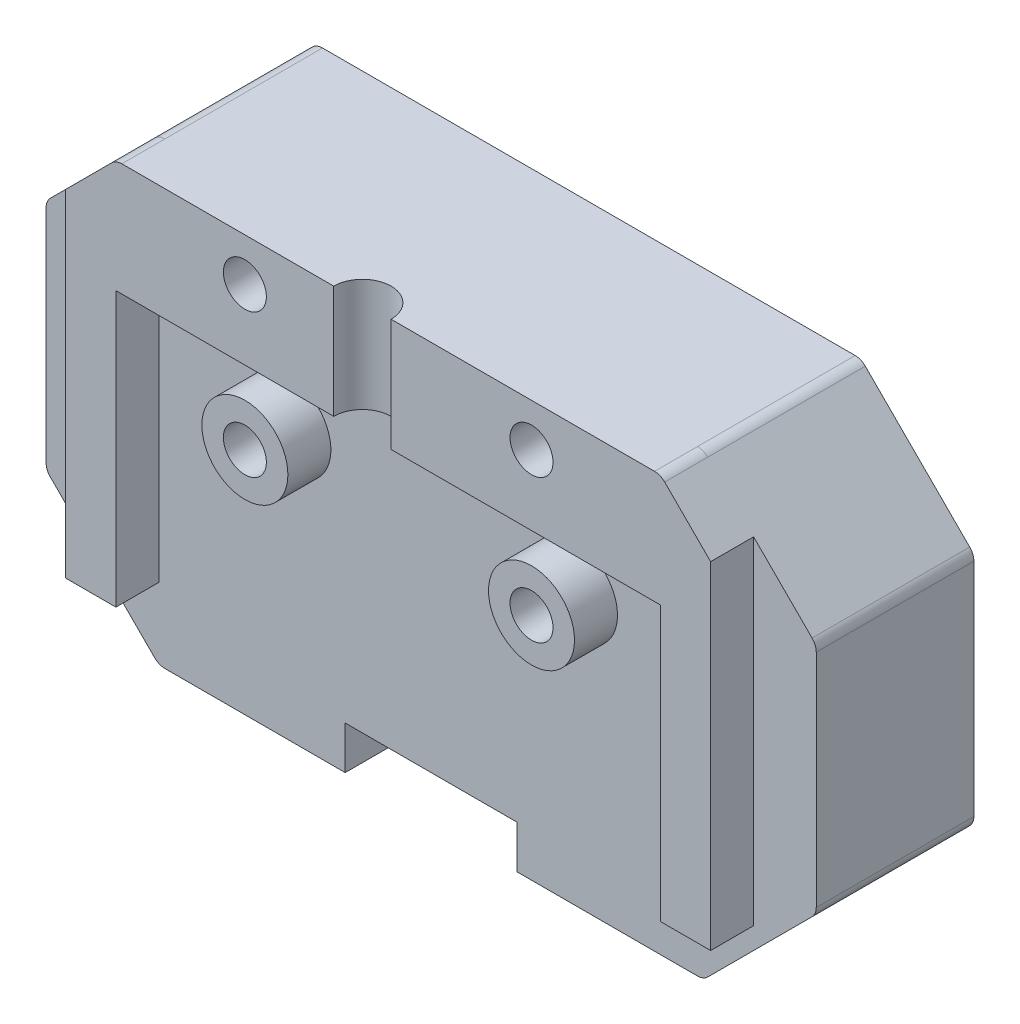
from build123d import *

# Parameters (mm, degrees)
CROQUIS3_W                   = 38
CROQUIS3_H                   = 38
SALIENTE_EXTRUIR9_DEPTH      = 1
SALIENTE_EXTRUIR10_START     = -11
SALIENTE_EXTRUIR10_OUTLINE_W = 38
SALIENTE_EXTRUIR10_OUTLINE_H = 38
SALIENTE_EXTRUIR10_DEPTH     = 10
CROQUIS13_W                  = 38
CROQUIS13_H                  = 38
SALIENTE_EXTRUIR15_DEPTH     = 3
CROQUIS14_R                  = 1.5
CORTAR_EXTRUIR1_DEPTH        = 14
CROQUIS15_W                  = 38
CROQUIS15_H                  = 24.129942315
CROQUIS15_R                  = 3.5
SALIENTE_EXTRUIR16_DEPTH     = 1
CORTAR_EXTRUIR2_DEPTH        = 14
SALIENTE_EXTRUIR17_DEPTH     = 5
SALIENTE_EXTRUIR18_DEPTH     = 5
CORTAR_EXTRUIR3_DEPTH        = 3
REDONDEO11_R                 = 1
CROQUIS21_R                  = 1.5
CORTAR_EXTRUIR4_DEPTH        = 11
SALIENTE_EXTRUIR20_START     = 3
CROQUIS22_R                  = 3
CROQUIS22_R_2                = 1.5
SALIENTE_EXTRUIR20_DEPTH     = 3


# Read off the part's stored shape, not the designer's step: Saliente-Extruir10
with BuildPart() as part:
    # Croquis3 → Saliente-Extruir9 (new body)
    with BuildSketch(Plane.XY.offset(5)):
        Polygon((19, -5.370057685), (26.870057685, 2.5), (26.870057685, 40.5), (19, 48.370057685), (-19, 48.370057685), (-26.870057685, 40.5), (-26.870057685, 2.5), (-19, -5.370057685), align=None)
        with Locations((0, 21.5)):
            Rectangle(CROQUIS3_W, CROQUIS3_H, mode=Mode.SUBTRACT)
    extrude(amount=-SALIENTE_EXTRUIR9_DEPTH)

    # Saliente-Extruir10 outline → Saliente-Extruir10 (add)
    with BuildSketch(Plane(origin=(0, 0, 4), x_dir=(-1, 0, 0), z_dir=(0, 0, -1)).offset(SALIENTE_EXTRUIR10_START)):
        Polygon((-26.870057685, 2.5), (-19, -5.370057685), (19, -5.370057685), (26.870057685, 2.5), (26.870057685, 40.5), (19, 48.370057685), (-19, 48.370057685), (-26.870057685, 40.5), align=None)
        with Locations((0, 21.5)):
            Rectangle(SALIENTE_EXTRUIR10_OUTLINE_W, SALIENTE_EXTRUIR10_OUTLINE_H, mode=Mode.SUBTRACT)
    extrude(amount=SALIENTE_EXTRUIR10_DEPTH)

    # Croquis13 → Saliente-Extruir15 (add)
    with BuildSketch(Plane.XY.offset(15)):
        with BuildLine():
            Line((-22.5, 44.870057685), (-22.5, -1))
            Line((-22.5, -1), (22.5, -1))
            Line((22.5, -1), (22.5, 44.870057685))
            Line((22.5, 44.870057685), (19.292893219, 48.077164466))
            ThreePointArc((19.292893219, 48.077164466), (18.96846987, 48.293937218), (18.585786438, 48.370057685))
            Line((18.585786438, 48.370057685), (-18.585786438, 48.370057685))
            ThreePointArc((-18.585786438, 48.370057685), (-18.96846987, 48.293937218), (-19.292893219, 48.077164466))
            Line((-19.292893219, 48.077164466), (-22.5, 44.870057685))
        make_face()
        with Locations((0, 21.5)):
            Rectangle(CROQUIS13_W, CROQUIS13_H, mode=Mode.SUBTRACT)
    extrude(amount=SALIENTE_EXTRUIR15_DEPTH)

    # Croquis14 → Cortar-Extruir1 (cut)
    with BuildSketch(Plane(origin=(0, 0, 4), x_dir=(-1, 0, 0), z_dir=(0, 0, -1))):
        with Locations((10, 45.37415474)):
            Circle(CROQUIS14_R)
        with Locations(Location((-10, 45.37415474, 0), (0, 0, 180))):
            Circle(CROQUIS14_R)
    extrude(amount=-CORTAR_EXTRUIR1_DEPTH, mode=Mode.SUBTRACT)

    # Croquis15 → Saliente-Extruir16 (add)
    with BuildSketch(Plane(origin=(0, 0, 4), x_dir=(-1, 0, 0), z_dir=(0, 0, -1))):
        with Locations((0, 28.435028843)):
            Rectangle(CROQUIS15_W, CROQUIS15_H)
        with Locations((0, 25.370057685)):
            Circle(CROQUIS15_R, mode=Mode.SUBTRACT)
    extrude(amount=-SALIENTE_EXTRUIR16_DEPTH)

    # Croquis16 → Cortar-Extruir2 (cut)
    with BuildSketch(Plane(origin=(0, 0, 4), x_dir=(-1, 0, 0), z_dir=(0, 0, -1))):
        Polygon((-19, 2.5), (-19, 16.370057685), (-26.870057685, 24.24011537), (-26.870057685, 2.5), (-19, -5.370057685), (19, -5.370057685), (26.870057685, 2.5), (26.870057685, 24.24011537), (19, 16.370057685), (19, 2.5), align=None)
    extrude(amount=-CORTAR_EXTRUIR2_DEPTH, mode=Mode.SUBTRACT)

    # Croquis17 → Saliente-Extruir17 (add)
    with BuildSketch(Plane.XY.offset(5)):
        Polygon((6, 31.370057685), (6, 25.370057685), (6, 19.370057685), (6, 16.370057685), (19, 16.370057685), (19, 40.5), (-19, 40.5), (-19, 16.370057685), (-6, 16.370057685), (-6, 19.370057685), (-6, 31.370057685), align=None)
    extrude(amount=SALIENTE_EXTRUIR17_DEPTH)

    # Croquis18 → Saliente-Extruir18 (add)
    with BuildSketch(Plane.XY.offset(10)):
        Polygon((-19, 40.5), (-19, 16.370057685), (-6, 16.370057685), (-6, 19.370057685), (6, 19.370057685), (6, 16.370057685), (19, 16.370057685), (19, 40.5), align=None)
    extrude(amount=SALIENTE_EXTRUIR18_DEPTH)

    # Croquis19 → Cortar-Extruir3 (cut)
    with BuildSketch(Plane.XY.offset(18)):
        Polygon((-22.5, 19.870057685), (-19, 16.370057685), (-19, 21.370057685), (-22.5, 21.370057685), align=None)
        Polygon((19, 16.370057685), (22.5, 19.870057685), (22.5, 21.370057685), (19, 21.370057685), align=None)
    extrude(amount=-CORTAR_EXTRUIR3_DEPTH, mode=Mode.SUBTRACT)

    # Redondeo11
    redondeo11_edges = [part.edges().sort_by_distance(p)[0] for p in [
        (26.870057685, 40.5, 10),
        (19, 48.370057685, 10),
        (-19, 48.370057685, 10),
        (-26.870057685, 40.5, 10),
        (26.870057685, 24.24011537, 9.5),
        (19, 16.370057685, 9.5),
        (-26.870057685, 24.24011537, 9.5),
        (-19, 16.370057685, 9.5),
    ]]
    fillet(redondeo11_edges, radius=REDONDEO11_R)

    # Croquis21 → Cortar-Extruir4 (cut)
    with BuildSketch(Plane.XY.offset(15)):
        with Locations((-10, 35.37415474)):
            Circle(CROQUIS21_R)
        with Locations((10, 35.37415474)):
            Circle(CROQUIS21_R)
    extrude(amount=-CORTAR_EXTRUIR4_DEPTH, mode=Mode.SUBTRACT)

    # Croquis22 → Saliente-Extruir20 (add)
    # profile 1 of 2: a face of its own
    with BuildSketch(Plane.XY.offset(15).offset(SALIENTE_EXTRUIR20_START)):
        with Locations(Location((-10, 35.37415474, 0), (0, 0, 180))):
            Circle(CROQUIS22_R)
        with Locations((-10, 35.37415474)):
            Circle(CROQUIS22_R_2, mode=Mode.SUBTRACT)
    # profile 2 of 2: a face of its own
    with BuildSketch(Plane.XY.offset(15).offset(SALIENTE_EXTRUIR20_START)):
        with Locations(Location((10, 35.37415474, 0), (0, 0, 180))):
            Circle(CROQUIS22_R)
        with Locations((10, 35.37415474)):
            Circle(CROQUIS22_R_2, mode=Mode.SUBTRACT)
    extrude(amount=-SALIENTE_EXTRUIR20_DEPTH)

    # Croquis23 → Cortar-Revolución1 (revolve, cut)
    with BuildSketch(Plane.XY.offset(18)):
        Polygon((-1.8, 48.370057685), (-1.8, 44.97415474), (-1.8, 40.5), (0.2, 40.5), (0.2, 48.370057685), align=None)
    revolve(axis=Axis((-1.8, 44.97415474, 18), (0, 1, 0)), mode=Mode.SUBTRACT)


solid = part.part
